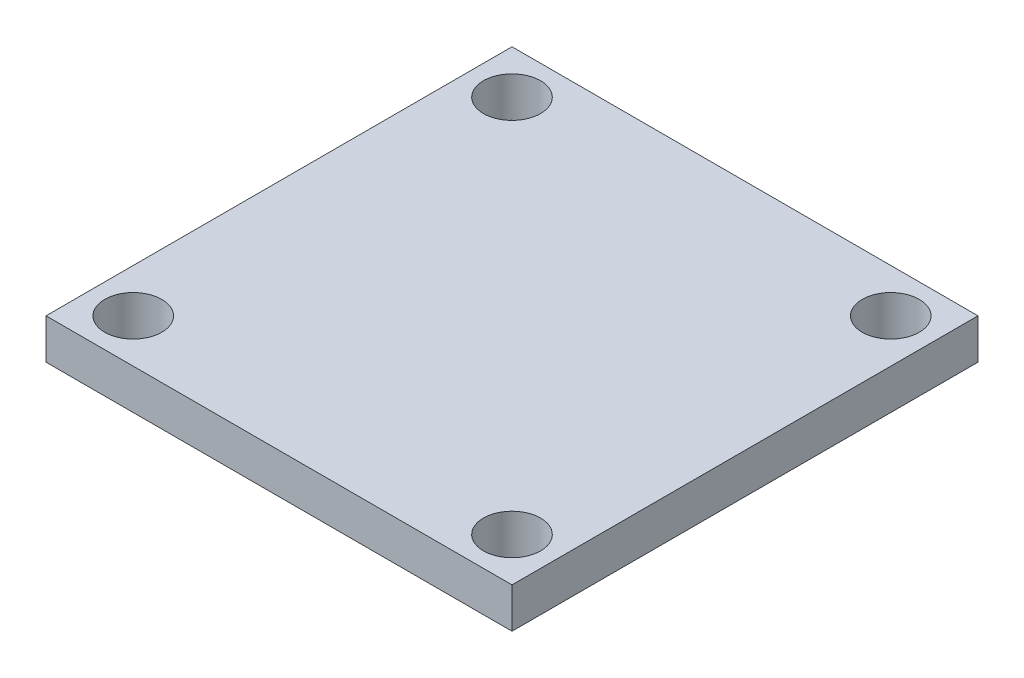
from build123d import *

# Parameters (mm, degrees)
SKETCH1_W           = 58
SKETCH1_H           = 58
SKETCH1_R           = 3.55
BOSS_EXTRUDE1_DEPTH = 5


with BuildPart() as part:
    # Sketch1 → Boss-Extrude1 (new body)
    with BuildSketch(Plane(origin=(0, 0, 0), x_dir=(1, 0, 0), z_dir=(0, 1, 0))):
        Rectangle(SKETCH1_W, SKETCH1_H)
        with Locations((-23.57, 23.57)):
            Circle(SKETCH1_R, mode=Mode.SUBTRACT)
        with Locations((23.57, 23.57)):
            Circle(SKETCH1_R, mode=Mode.SUBTRACT)
        with Locations((23.57, -23.57)):
            Circle(SKETCH1_R, mode=Mode.SUBTRACT)
        with Locations((-23.57, -23.57)):
            Circle(SKETCH1_R, mode=Mode.SUBTRACT)
    extrude(amount=BOSS_EXTRUDE1_DEPTH)


solid = part.part
